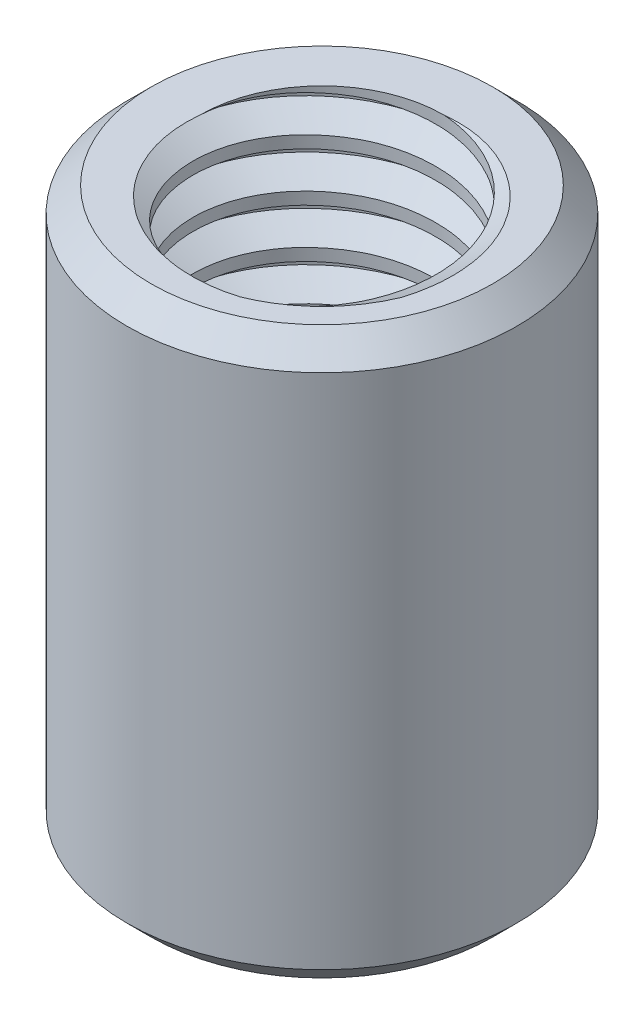
from build123d import *

# Parameters (mm, degrees)
SKETCH1_R               = 2
BOSS_EXTRUDE1_DEPTH     = 5.8
TAP_DRILL_FOR_M3_TAP1_D = 2.5
THREAD1_PITCH           = 0.5
CHAMFER1_SIZE           = 0.25


with BuildPart() as part:
    # Sketch1 → Boss-Extrude1 (new body)
    with BuildSketch(Plane(origin=(0, 0, 0), x_dir=(1, 0, 0), z_dir=(0, 1, 0))):
        with Locations(Location((0, 0, 0), (0, 0, 270))):
            Circle(SKETCH1_R)
    extrude(amount=BOSS_EXTRUDE1_DEPTH)

    # Tap Drill for M3 Tap1 (through all)
    with Locations(Plane(origin=(0, 5.8, 0), x_dir=(1, 0, 0), z_dir=(0, 1, 0))):
        with Locations((0, 0)):
            Hole(TAP_DRILL_FOR_M3_TAP1_D / 2)

    # Thread1: the profile of Thread Profile1 profile screwed along a right-hand helix of 20 turns, 6 arcs to a turn; built about Z, then put on its axis
    thread1_z = Axis((0, 0, 0), (0, 0, 1))
    thread1_corners = [(1.2497, 0, -0.000173205), (1.520632937, 0, 0.156249999), (1.520632937, 0, 0.218749999), (1.2497, 0, 0.375173204)]
    with BuildLine(mode=Mode.PRIVATE) as thread1_profile:
        Line(thread1_corners[0], thread1_corners[1])
        Line(thread1_corners[1], thread1_corners[2])
        Line(thread1_corners[2], thread1_corners[3])
        Line(thread1_corners[3], thread1_corners[0])
    thread1_cap = Face(thread1_profile.wire())
    thread1_turn_angles = [0, 30, 60, 90, 120, 150, 180, 210, 240, 270, 300, 330, 360]
    thread1_turn_weights = [1, 0.8660254037844387, 1, 0.8660254037844387, 1, 0.8660254037844387, 1, 0.8660254037844387, 1, 0.8660254037844387, 1, 0.8660254037844387, 1]
    thread1_turn_rails = [Edge.make_bspline([Vector(p[0], p[1], 0).rotate(thread1_z, thread1_turn_angles[k]) / thread1_turn_weights[k] + Vector(0, 0, p[2] + THREAD1_PITCH * thread1_turn_angles[k] / 360) for k in range(13)], [0, 0, 0, 1, 1, 2, 2, 3, 3, 4, 4, 5, 5, 6, 6, 6], 2, thread1_turn_weights) for p in thread1_corners]
    thread1_turn_sides = [Face.make_surface_from_curves(thread1_turn_rails[p[0]], thread1_turn_rails[p[1]]) for p in [(0, 1), (1, 2), (2, 3), (3, 0)]]
    thread1 = Plane(origin=(0, 6.8, 0), x_dir=(-1, 0, 0), z_dir=(0, -1, 0)) * Solid(Shell([*[p.moved(Location((0, 0, THREAD1_PITCH * i))) for i in range(20) for p in thread1_turn_sides], thread1_cap, thread1_cap.rotate(thread1_z, 7200).moved(Location((0, 0, THREAD1_PITCH * 7200 / 360)))]))
    add(thread1, mode=Mode.SUBTRACT)

    # Chamfer1
    chamfer1_edges = [part.edges().sort_by_distance(p)[0] for p in [
        (0, 0, -2),
        (0, 5.8, -2),
    ]]
    chamfer(chamfer1_edges, length=CHAMFER1_SIZE)


solid = part.part
